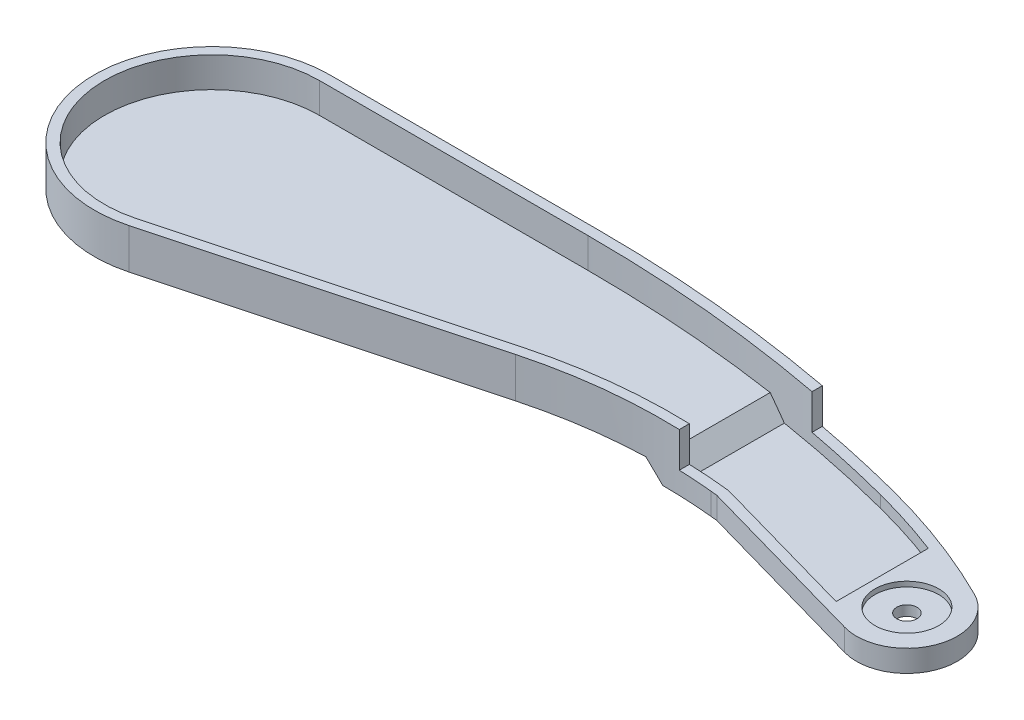
from build123d import *

# Parameters (mm, degrees)
SKETCH_1_R          = 35.00000000000001
SKETCH_1_R_2        = 14.999999999998519
SKETCH_1_R_3        = 2.999999999998513
EXTRUDE_1_DEPTH     = 3
EXTRUDE_2_DEPTH     = 9
EXTRUDE_START       = 5
SKETCH_3_R          = 2.999999999998504
EXTRUDE_3_DEPTH     = 5
CHAMFER_2_SIZE      = 5
CUT_EXTRUDE_START   = -5
SKETCH_5_R          = 2.9999999999987814
CUT_EXTRUDE_1_DEPTH = 5
CHAMFER_3_SIZE      = 5
CUT_EXTRUDE_START_2 = -10.5
CUT_EXTRUDE_2_DEPTH = 10.5
SKETCH_7_R          = 2.9999999999981983
EXTRUDE_5_DEPTH     = 3.5
CUT_EXTRUDE_START_3 = -1.5
SKETCH_8_R          = 9.499999999999694
SKETCH_8_R_2        = 2.9999999999981988
CUT_EXTRUDE_3_DEPTH = 1.5
SKETCH_9_R          = 7.000000000000014
CUT_EXTRUDE_4_DEPTH = 2


with BuildPart() as part:
    # 草图1 → 凸台-拉伸1 (new body)
    # profile 1 of 3: a face of its own
    with BuildSketch(Plane(origin=(0, 0, 0), x_dir=(1, 0, 0), z_dir=(0, 1, 0))):
        Circle(SKETCH_1_R)
    # profile 2 of 3: a face of its own
    with BuildSketch(Plane(origin=(0, 0, 0), x_dir=(1, 0, 0), z_dir=(0, 1, 0))):
        with BuildLine():
            Line((80, 35.00000000000001), (0, 35.00000000000001))
            ThreePointArc((2.14e-15, 35.00000000000001), (24.74873734152917, 24.748737341529168), (35.00000000000001, 0))
            ThreePointArc((35.00000000000001, -8.57e-15), (27.76736691019325, -21.306650015305213), (9.058666578588273, -33.80740392011739))
            Line((9.058666578588266, -33.80740392011739), (99.85569424976063, -9.478413680480333))
            ThreePointArc((99.85569424976065, -9.478413680480344), (126.61144649660456, -4.8534588703142845), (153.76260315826568, -5.127643524347377))
            Line((153.76260315826565, -5.127643524347345), (155.75246507959224, -5.328764219589036))
            Line((155.75246507959224, -5.328764219589036), (208.84160576054387, -20.322897386273407))
            ThreePointArc((208.84160576054387, -20.322897386273397), (198.92789824314943, -0.47835413257180903), (219.61266324779353, 7.5358825990905824))
            ThreePointArc((219.61266324779353, 7.53588259909057), (200.54444782077312, 15.836627562355744), (180.7173501180477, 22.11240665367282))
            ThreePointArc((180.71735011804773, 22.112406653672906), (130.7692689455484, 31.765020296314162), (80, 35.00000000000006))
        make_face()
    # profile 3 of 3: a face of its own
    with BuildSketch(Plane(origin=(0, 0, 0), x_dir=(1, 0, 0), z_dir=(0, 1, 0))):
        with Locations((212.91861413363648, -5.887593346327154)):
            Circle(SKETCH_1_R_2)
        with Locations(Location((212.91861413363648, -5.887593346327154, 0), (0, 0, 270))):
            Circle(SKETCH_1_R_3, mode=Mode.SUBTRACT)
    extrude(amount=EXTRUDE_1_DEPTH)

    # 草图2 → 凸台-拉伸2 (add)
    with BuildSketch(Plane(origin=(0, 3, 0), x_dir=(1, 0, 0), z_dir=(0, 1, 0))):
        with BuildLine():
            ThreePointArc((2.14e-15, 35), (-34.70057014808337, -4.5684167277018295), (9.058666578588264, -33.807403920117395))
            Line((9.058666578588271, -33.80740392011739), (99.85569424976065, -9.478413680480333))
            ThreePointArc((99.85569424976063, -9.478413680480287), (126.61144649660456, -4.853458870314313), (153.76260315826565, -5.127643524347235))
            Line((153.76260315826565, -5.127643524347247), (155.75246507959224, -5.328764219589035))
            Line((155.75246507959224, -5.328764219589035), (208.84160576054387, -20.3228973862734))
            ThreePointArc((208.84160576054387, -20.322897386273414), (226.9093300241235, -11.296832560082503), (219.61266324779353, 7.535882599090587))
            ThreePointArc((219.61266324779353, 7.535882599090655), (200.54444782077314, 15.83662756235583), (180.71735011804776, 22.112406653672934))
            ThreePointArc((180.71735011804773, 22.112406653672906), (130.76926894554842, 31.765020296314162), (80.00000000000003, 35))
            Line((80.00000000000003, 35.00000000000003), (0, 35))
        make_face()
        with BuildLine():
            Line((99.0792371144531, -6.580636201613121), (8.282209443280715, -30.909626441250172))
            ThreePointArc((8.282209443280705, -30.909626441250175), (-31.726235563961932, -4.176838151041671), (1.96e-15, 32))
            Line((0, 32), (80.00000000000007, 32.00000000000003))
            ThreePointArc((80.00000000000009, 31.999999999999943), (130.3884994284568, 28.789282644091656), (179.96196999216235, 19.20906360377029))
            ThreePointArc((179.96196999216238, 19.209063603770403), (199.49166122934687, 13.027421198822964), (218.273853424962, 4.851187410006787))
            ThreePointArc((218.27385342496197, 4.851187410006782), (224.11118684602587, -10.214984717331333), (209.65700743516246, -17.43583657828386))
            Line((209.65700743516246, -17.435836578283872), (156.31528166260176, -2.370365008850316))
            Line((156.31528166260176, -2.370365008850316), (154.06428420112817, -2.1428506423573914))
            ThreePointArc((154.06428420112817, -2.142850642357388), (126.37010440623386, -1.8631822952438597), (99.0792371144531, -6.5806362016131175))
        make_face(mode=Mode.SUBTRACT)
    extrude(amount=EXTRUDE_2_DEPTH)

    # 草图3 → 凸台-拉伸3 (add)
    # profile 1 of 2: a face of its own
    with BuildSketch(Plane.XZ.offset(EXTRUDE_START)):
        with BuildLine():
            ThreePointArc((219.61266324779353, -7.535882599090586), (198.92789824314943, 0.47835413257181436), (208.84160576054387, 20.322897386273397))
            Line((208.84160576054387, 20.322897386273407), (155.75246507959224, 5.328764219589036))
            Line((155.75246507959224, 5.328764219589036), (153.76260315826562, 5.127643524347275))
            ThreePointArc((153.76260315826562, 5.127643524347263), (146.23015300001683, 4.557497197907537), (138.6785510151405, 4.36728762384061))
            Line((138.6785510151405, 4.36728762384056), (138.67855101513894, -30.67262686564981))
            ThreePointArc((138.6785510151389, -30.672626865649704), (159.81279763944207, -26.9565247995821), (180.71735011804768, -22.112406653672792))
            ThreePointArc((180.7173501180477, -22.112406653672878), (200.54444782077314, -15.836627562355801), (219.6126632477936, -7.535882599090598))
        make_face()
    # profile 2 of 2: a face of its own
    with BuildSketch(Plane.XZ.offset(EXTRUDE_START)):
        with BuildLine():
            ThreePointArc((227.918614133635, 5.887593346327154), (221.96971556947213, 17.84909671330278), (208.84160576054387, 20.322897386273397))
            ThreePointArc((208.84160576054387, 20.322897386273397), (198.92789824314943, 0.47835413257181436), (219.61266324779353, -7.535882599090586))
            ThreePointArc((219.61266324779353, -7.535882599090586), (225.6742155838289, -2.0051014814110157), (227.918614133635, 5.887593346327151))
        make_face()
        with Locations(Location((212.91861413363648, 5.887593346327154, 0), (0, 0, 270))):
            Circle(SKETCH_3_R, mode=Mode.SUBTRACT)
    extrude(amount=-EXTRUDE_3_DEPTH)

    # 倒角2
    chamfer_2_edges = [part.edges().sort_by_distance(p)[0] for p in [
        (138.6785510151397, 0, -13.152669620904625),
    ]]
    chamfer(chamfer_2_edges, length=CHAMFER_2_SIZE - 0.0001)  # a hair under: the kernel refuses the full size

    # 草图5 → 切除-拉伸1 (cut)
    # profile 1 of 2: a face of its own
    with BuildSketch(Plane(origin=(0, 3, 0), x_dir=(1, 0, 0), z_dir=(0, 1, 0)).offset(CUT_EXTRUDE_START)):
        with BuildLine():
            ThreePointArc((179.96196999216247, 19.209063603770403), (159.43218530873725, 23.972399968273407), (138.6785510151319, 27.639564550956322))
            Line((138.67855101513908, 27.639564550957424), (138.67855101514036, -1.3672876238405252))
            ThreePointArc((138.67855101514482, -1.3672876238405536), (146.38118503971654, -1.561301389388916), (154.06428420112817, -2.142850642357331))
            Line((154.06428420112817, -2.1428506423573634), (156.31528166260176, -2.370365008850312))
            Line((156.31528166260176, -2.370365008850312), (200.99582501119374, -14.989631554428025))
            ThreePointArc((200.9958250111938, -14.989631554427945), (198.86414193463486, -0.6462374904961061), (209.86727048552746, 8.798771143944375))
            ThreePointArc((209.8672704855274, 8.798771143943867), (195.1241257664407, 14.605756926583496), (179.96196999216244, 19.209063603770346))
        make_face()
    # profile 2 of 2: a face of its own
    with BuildSketch(Plane(origin=(0, 3, 0), x_dir=(1, 0, 0), z_dir=(0, 1, 0)).offset(CUT_EXTRUDE_START)):
        with BuildLine():
            ThreePointArc((218.273853424962, 4.851187410006787), (214.09382814337536, 6.874525823264776), (209.8672704855274, 8.798771143943867))
            ThreePointArc((209.86727048552746, 8.798771143944375), (198.86414193463486, -0.6462374904961061), (200.9958250111938, -14.989631554427945))
            Line((200.99582501119374, -14.989631554428025), (209.65700743516246, -17.435836578283855))
            ThreePointArc((209.65700743516246, -17.435836578283855), (224.11118684602584, -10.214984717331326), (218.27385342496197, 4.851187410006769))
        make_face()
        with Locations(Location((212.91861413363648, -5.887593346327154, 0), (0, 0, 90))):
            Circle(SKETCH_5_R, mode=Mode.SUBTRACT)
    extrude(amount=CUT_EXTRUDE_1_DEPTH, mode=Mode.SUBTRACT)

    # 倒角3
    chamfer_3_edges = [part.edges().sort_by_distance(p)[0] for p in [
        (138.6785510151397, -2, -13.13613846355845),
    ]]
    chamfer(chamfer_3_edges, length=CHAMFER_3_SIZE - 0.0001)  # a hair under: the kernel refuses the full size

    # 草图6 → 切除-拉伸2 (cut)
    with BuildSketch(Plane(origin=(0, 12, 0), x_dir=(1, 0, 0), z_dir=(0, 1, 0)).offset(CUT_EXTRUDE_START_2)):
        with BuildLine():
            ThreePointArc((180.71735011804762, 22.112406653672963), (167.25029047437937, 25.368270754855814), (153.67855101513908, 28.155784798226705))
            Line((153.67855101513908, 28.155784798226733), (153.67855101513908, 25.103154460854327))
            ThreePointArc((153.6785510151392, 25.103154460854853), (166.8702636733634, 22.37908731541046), (179.96196999216247, 19.209063603770403))
            ThreePointArc((179.96196999216244, 19.209063603770375), (199.4916612293469, 13.027421198822992), (218.273853424962, 4.8511874100068155))
            ThreePointArc((218.27385342496197, 4.851187410006791), (224.11118684602587, -10.214984717331326), (209.65700743516246, -17.435836578283855))
            Line((209.65700743516246, -17.43583657828387), (156.31528166260176, -2.370365008850314))
            Line((156.31528166260176, -2.370365008850314), (154.06428420112817, -2.1428506423573634))
            ThreePointArc((154.06428420112817, -2.1428506423573594), (148.87731974032897, -1.707583980442621), (143.67855101514033, -1.4490087949183987))
            Line((143.67855101514033, -1.4490087949183827), (143.67855101514033, -4.450644118191127))
            ThreePointArc((143.67855101514033, -4.450644118191121), (148.72628059305634, -4.704188864229678), (153.76260315826565, -5.127643524347263))
            Line((153.76260315826565, -5.127643524347275), (155.7524650795923, -5.328764219589041))
            Line((155.7524650795923, -5.328764219589041), (208.84160576054387, -20.322897386273397))
            ThreePointArc((208.84160576054387, -20.32289738627341), (226.90933002412353, -11.296832560082489), (219.6126632477935, 7.535882599090598))
            ThreePointArc((219.61266324779353, 7.535882599090627), (200.54444782077303, 15.836627562355801), (180.7173501180476, 22.112406653672906))
        make_face()
    extrude(amount=CUT_EXTRUDE_2_DEPTH, mode=Mode.SUBTRACT)

    # 草图7 → 凸台-拉伸5 (add)
    # profile 1 of 3: a face of its own
    with BuildSketch(Plane(origin=(0, -2, 0), x_dir=(1, 0, 0), z_dir=(0, 1, 0))):
        with BuildLine():
            ThreePointArc((218.273853424962, 4.8511874100068155), (209.68814372522309, 8.87768125206452), (200.91861413363713, 12.48633951388669))
            Line((200.91861413363716, 12.486339513886715), (200.91861413363796, -5.887593233665726))
            ThreePointArc((200.91861413363787, -5.88759323366572), (206.60445831934817, 4.31688784346667), (218.273853424962, 4.851187410006878))
        make_face()
    # profile 2 of 3: a face of its own
    with BuildSketch(Plane(origin=(0, -2, 0), x_dir=(1, 0, 0), z_dir=(0, 1, 0))):
        with BuildLine():
            ThreePointArc((218.273853424962, 4.851187410006878), (206.60445831934817, 4.31688784346667), (200.91861413363787, -5.88759323366572))
            ThreePointArc((200.91861413363787, -5.887593233665726), (203.3494114060658, -13.128474450075544), (209.65700743516243, -17.43583657828395))
            ThreePointArc((209.65700743516243, -17.43583657828395), (220.15949528230487, -15.456796039907507), (224.9186141336351, -5.887593346327157))
            ThreePointArc((224.9186141336351, -5.887593346327154), (223.12309529379024, 0.4265625158632913), (218.273853424962, 4.851187410006878))
        make_face()
        with Locations(Location((212.91861413363648, -5.887593346327154, 0), (0, 0, 90))):
            Circle(SKETCH_7_R, mode=Mode.SUBTRACT)
    # profile 3 of 3: a face of its own
    with BuildSketch(Plane(origin=(0, -2, 0), x_dir=(1, 0, 0), z_dir=(0, 1, 0))):
        with BuildLine():
            ThreePointArc((209.65700743516243, -17.43583657828395), (203.3494114060658, -13.128474450075544), (200.91861413363787, -5.887593233665726))
            Line((200.91861413363796, -5.887593233665726), (200.91861413363836, -14.9678246431627))
            Line((200.91861413363836, -14.967824643162707), (209.65700743516246, -17.43583657828387))
        make_face()
    extrude(amount=EXTRUDE_5_DEPTH)

    # 草图8 → 切除-拉伸3 (cut)
    with BuildSketch(Plane(origin=(0, 1.4999999999999996, 0), x_dir=(1, 0, 0), z_dir=(0, 1, 0)).offset(CUT_EXTRUDE_START_3)):
        with Locations(Location((212.91861413363648, -5.887593346327154, 0), (0, 0, 270))):
            Circle(SKETCH_8_R)
        with Locations(Location((212.91861413363648, -5.887593346327154, 0), (0, 0, 90))):
            Circle(SKETCH_8_R_2, mode=Mode.SUBTRACT)
    extrude(amount=CUT_EXTRUDE_3_DEPTH, mode=Mode.SUBTRACT)

    # 草图9 → 切除-拉伸4 (cut)
    with BuildSketch(Plane.XZ.offset(5)):
        with Locations(Location((212.91861413363645, 5.887593346328139, 0), (0, 0, 270))):
            Circle(SKETCH_9_R)
    extrude(amount=-CUT_EXTRUDE_4_DEPTH, mode=Mode.SUBTRACT)


solid = part.part
